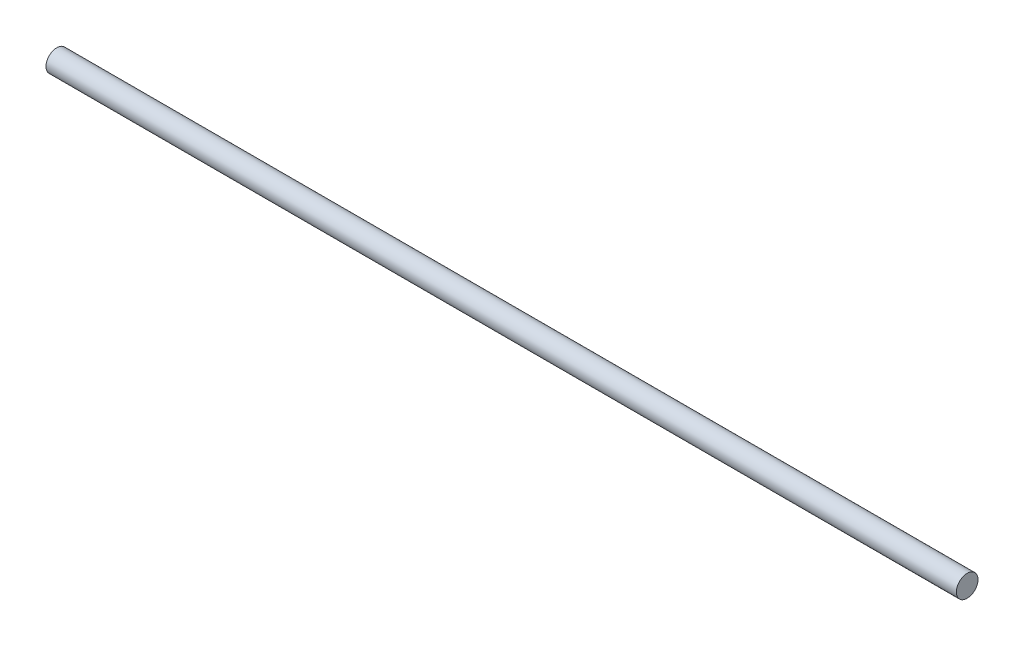
from build123d import *

# Parameters (mm, degrees)
SKETCH1_R           = 1.25
BOSS_EXTRUDE1_DEPTH = 105


with BuildPart() as part:
    # Sketch1 → Boss-Extrude1 (new body)
    with BuildSketch(Plane(origin=(0, 0, 0), x_dir=(0, 0, -1), z_dir=(1, 0, 0))):
        Circle(SKETCH1_R)
    extrude(amount=BOSS_EXTRUDE1_DEPTH)


solid = part.part
